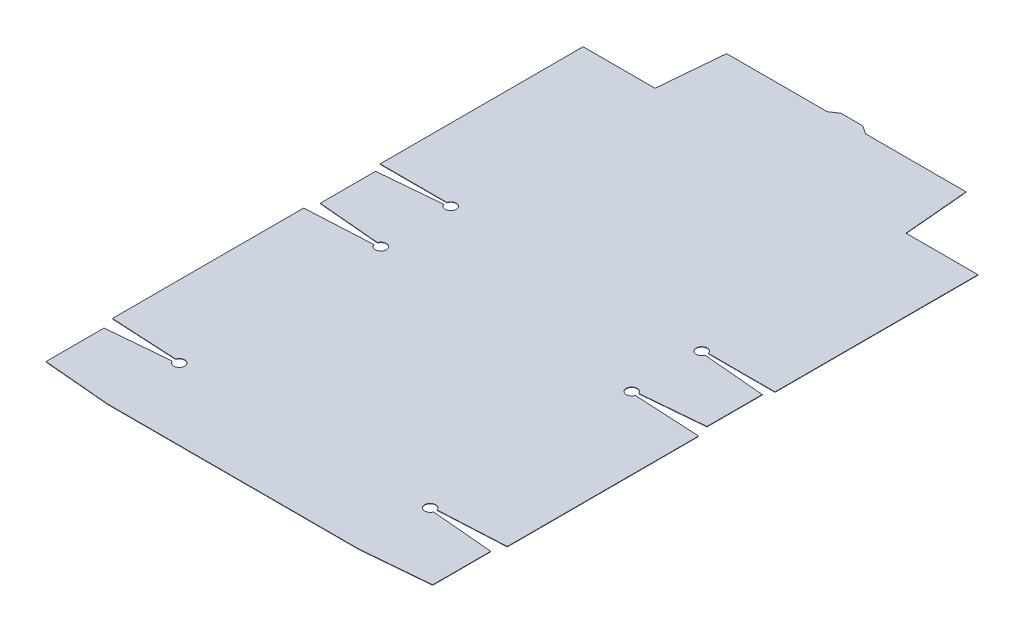
from build123d import *

# Parameters (mm, degrees)
EXTRUDE1_DEPTH = 0.4572
EXTRUDE2_REACH = 567.039
SKETCH2_R      = 6.35
EXTRUDE3_REACH = 567.039


with BuildPart() as part:
    # Sketch1 → Extrude1 (new body)
    with BuildSketch(Plane(origin=(0, 0, 0), x_dir=(1, 0, 0), z_dir=(0, 1, 0))):
        with BuildLine():
            Line((145.25625, 434.18125), (138.034060826, 516.73125))
            Line((138.034060826, 516.73125), (-138.034060826, 516.73125))
            Line((-138.034060826, 516.73125), (-145.25625, 434.18125))
            Line((-145.25625, 434.18125), (-228.6, 434.18125))
            Line((-228.6, 434.18125), (-228.6, 199.23125))
            Line((-228.6, 199.23125), (-145.25625, 199.23125))
            ThreePointArc((-145.25625, 199.23125), (-143.670260948, 197.712995777), (-145.117890258, 196.062290917))
            Line((-145.117890258, 196.062290917), (-223.8375, 189.175217467))
            Line((-223.8375, 189.175217467), (-223.8375, 125.149782533))
            Line((-223.8375, 125.149782533), (-145.117890258, 118.262709083))
            ThreePointArc((-145.117890258, 118.262709083), (-143.668991784, 116.653544305), (-145.173166669, 115.095925614))
            Line((-145.173166669, 115.095925614), (-228.6, 110.723710546))
            Line((-228.6, 110.723710546), (-228.6, -110.723710546))
            Line((-228.6, -110.723710546), (-145.173166669, -115.095925614))
            ThreePointArc((-145.173166669, -115.095925614), (-143.668991784, -116.653544305), (-145.117890258, -118.262709083))
            Line((-145.117890258, -118.262709083), (-223.8375, -125.149782533))
            Line((-223.8375, -125.149782533), (-223.8375, -192.356281459))
            Line((-223.8375, -192.356281459), (-145.25625, -199.23125))
            Line((-145.25625, -199.23125), (145.25625, -199.23125))
            Line((145.25625, -199.23125), (223.8375, -192.356281459))
            Line((223.8375, -192.356281459), (223.8375, -125.149782533))
            Line((223.8375, -125.149782533), (145.117890258, -118.262709083))
            ThreePointArc((145.117890258, -118.262709083), (143.668991784, -116.653544305), (145.173166669, -115.095925614))
            Line((145.173166669, -115.095925614), (228.6, -110.723710546))
            Line((228.6, -110.723710546), (228.6, 110.723710546))
            Line((228.6, 110.723710546), (145.173166669, 115.095925614))
            ThreePointArc((145.173166669, 115.095925614), (143.668991784, 116.653544305), (145.117890258, 118.262709083))
            Line((145.117890258, 118.262709083), (223.8375, 125.149782533))
            Line((223.8375, 125.149782533), (223.8375, 189.175217467))
            Line((223.8375, 189.175217467), (145.117890258, 196.062290917))
            ThreePointArc((145.117890258, 196.062290917), (143.670260948, 197.712995777), (145.25625, 199.23125))
            Line((145.25625, 199.23125), (228.6, 199.23125))
            Line((228.6, 199.23125), (228.6, 434.18125))
            Line((228.6, 434.18125), (145.25625, 434.18125))
        make_face()
    extrude(amount=EXTRUDE1_DEPTH)

    # Sketch2 → Extrude2 (cut, up to next)
    with BuildSketch(Plane(origin=(0, 0.4572, 0), x_dir=(1, 0, 0), z_dir=(0, 1, 0)), mode=Mode.PRIVATE) as extrude2_sk1:
        with Locations((-145.25625, 116.68125)):
            Circle(SKETCH2_R)
    extrude2_tool1 = extrude(extrude2_sk1.sketch, amount=-EXTRUDE2_REACH, mode=Mode.PRIVATE) & part.part
    # Sketch2 → Extrude2 (cut, up to next)
    with BuildSketch(Plane(origin=(0, 0.4572, 0), x_dir=(1, 0, 0), z_dir=(0, 1, 0)), mode=Mode.PRIVATE) as extrude2_sk2:
        with Locations((-145.25625, -116.68125)):
            Circle(SKETCH2_R)
    extrude2_tool2 = extrude(extrude2_sk2.sketch, amount=-EXTRUDE2_REACH, mode=Mode.PRIVATE) & part.part
    # Sketch2 → Extrude2 (cut, up to next)
    with BuildSketch(Plane(origin=(0, 0.4572, 0), x_dir=(1, 0, 0), z_dir=(0, 1, 0)), mode=Mode.PRIVATE) as extrude2_sk3:
        with Locations((145.25625, -116.68125)):
            Circle(SKETCH2_R)
    extrude2_tool3 = extrude(extrude2_sk3.sketch, amount=-EXTRUDE2_REACH, mode=Mode.PRIVATE) & part.part
    # Sketch2 → Extrude2 (cut, up to next)
    with BuildSketch(Plane(origin=(0, 0.4572, 0), x_dir=(1, 0, 0), z_dir=(0, 1, 0)), mode=Mode.PRIVATE) as extrude2_sk4:
        with Locations((145.25625, 116.68125)):
            Circle(SKETCH2_R)
    extrude2_tool4 = extrude(extrude2_sk4.sketch, amount=-EXTRUDE2_REACH, mode=Mode.PRIVATE) & part.part
    # Sketch2 → Extrude2 (cut, up to next)
    with BuildSketch(Plane(origin=(0, 0.4572, 0), x_dir=(1, 0, 0), z_dir=(0, 1, 0)), mode=Mode.PRIVATE) as extrude2_sk5:
        with Locations((-145.25625, 197.64375)):
            Circle(SKETCH2_R)
    extrude2_tool5 = extrude(extrude2_sk5.sketch, amount=-EXTRUDE2_REACH, mode=Mode.PRIVATE) & part.part
    # Sketch2 → Extrude2 (cut, up to next)
    with BuildSketch(Plane(origin=(0, 0.4572, 0), x_dir=(1, 0, 0), z_dir=(0, 1, 0)), mode=Mode.PRIVATE) as extrude2_sk6:
        with Locations((145.25625, 197.64375)):
            Circle(SKETCH2_R)
    extrude2_tool6 = extrude(extrude2_sk6.sketch, amount=-EXTRUDE2_REACH, mode=Mode.PRIVATE) & part.part
    add(extrude2_tool1.solids().sort_by_distance((-145.25625, 0.4572, -116.68125))[0], mode=Mode.SUBTRACT)
    add(extrude2_tool2.solids().sort_by_distance((-145.25625, 0.4572, 116.68125))[0], mode=Mode.SUBTRACT)
    add(extrude2_tool3.solids().sort_by_distance((145.25625, 0.4572, 116.68125))[0], mode=Mode.SUBTRACT)
    add(extrude2_tool4.solids().sort_by_distance((145.25625, 0.4572, -116.68125))[0], mode=Mode.SUBTRACT)
    add(extrude2_tool5.solids().sort_by_distance((-145.25625, 0.4572, -197.64375))[0], mode=Mode.SUBTRACT)
    add(extrude2_tool6.solids().sort_by_distance((145.25625, 0.4572, -197.64375))[0], mode=Mode.SUBTRACT)

    # Sketch12 → Extrude3 (cut, up to next)
    with BuildSketch(Plane(origin=(0, 0.4572, 0), x_dir=(1, 0, 0), z_dir=(0, 1, 0)), mode=Mode.PRIVATE) as extrude3_sk1:
        Polygon((-138.589613839, 510.38125), (-22.225, 510.38125), (-12.7, 516.73125), (-138.034060826, 516.73125), align=None)
    extrude3_tool1 = extrude(extrude3_sk1.sketch, amount=-EXTRUDE3_REACH, mode=Mode.PRIVATE) & part.part
    # Sketch12 → Extrude3 (cut, up to next)
    with BuildSketch(Plane(origin=(0, 0.4572, 0), x_dir=(1, 0, 0), z_dir=(0, 1, 0)), mode=Mode.PRIVATE) as extrude3_sk2:
        Polygon((12.7, 516.73125), (22.225, 510.38125), (138.589613839, 510.38125), (138.034060826, 516.73125), align=None)
    extrude3_tool2 = extrude(extrude3_sk2.sketch, amount=-EXTRUDE3_REACH, mode=Mode.PRIVATE) & part.part
    add(extrude3_tool1.solids().sort_by_distance((-77.855995, 0.4572, -513.595525))[0], mode=Mode.SUBTRACT)
    add(extrude3_tool2.solids().sort_by_distance((77.855995, 0.4572, -513.595525))[0], mode=Mode.SUBTRACT)


solid = part.part
